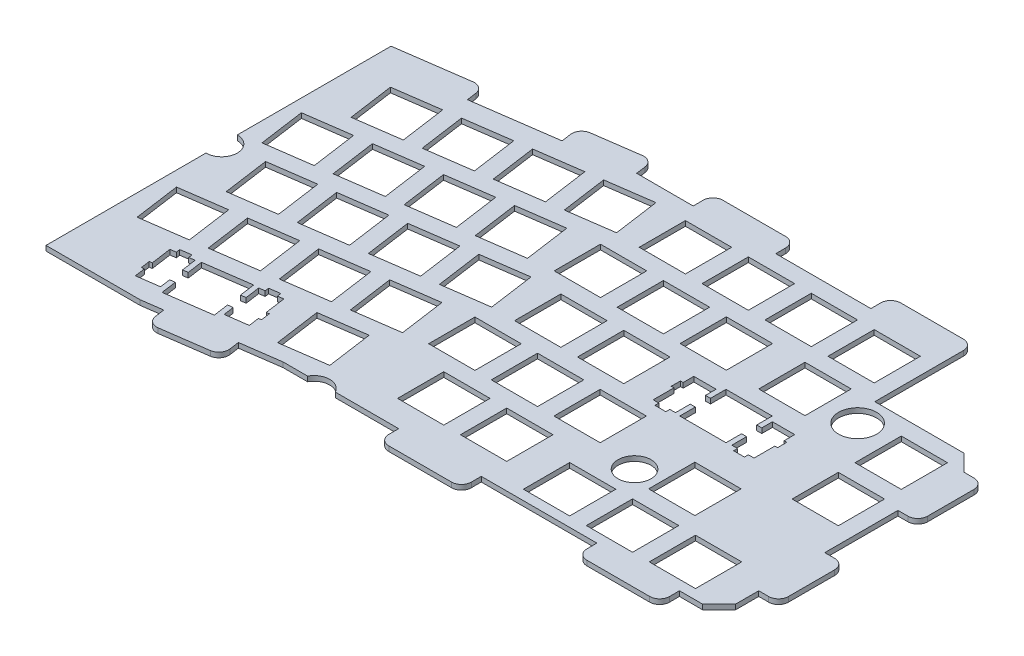
from build123d import *

# Parameters (mm, degrees)
BOSS_EXTRUDE1_DEPTH     = 1.5
SKETCH2_W               = 14
SKETCH2_H               = 14
CUT_EXTRUDE1_DEPTH      = 1.5
CUT_EXTRUDE2_DEPTH      = 10
SKETCH4_W               = 25
SKETCH4_H               = 6
SKETCH4_W_2             = 6
SKETCH4_H_2             = 20
BOSS_EXTRUDE2_DEPTH     = 1.5
FILLET1_R               = 3
CHAMFER1_SIZE           = 5
CUT_EXTRUDE3_DEPTH      = 356.457181103
SKETCH6_R               = 4.75
CUT_EXTRUDE4_DEPTH      = 10
SKETCH7_R               = 5.75
SKETCH7_R_2             = 5
CUT_EXTRUDE5_DEPTH      = 356.457181103
SKETCH8_W               = 5.051158106
SKETCH8_H               = 14
SKETCH8_W_2             = 3.300200616
SKETCH8_H_2             = 0.970158975
BOSS_EXTRUDE3_DEPTH     = 1.5
CUT_EXTRUDE6_DEPTH      = 356.457181103
CUT_EXTRUDE6_DEPTH_BACK = 356.457181103
SKETCH9_R               = 4.75
SKETCH11_W              = 14
SKETCH11_H              = 14
BOSS_EXTRUDE4_DEPTH     = 1.5
SKETCH12_W              = 14
SKETCH12_H              = 14
CUT_EXTRUDE7_DEPTH      = 1.5


with BuildPart() as part:
    # Sketch1 → Boss-Extrude1 (new body)
    with BuildSketch(Plane(origin=(0, 0, 0), x_dir=(1, 0, 0), z_dir=(0, 1, 0))):
        Polygon((219.154120864, 94.45473243), (218.917531506, 96.138153182), (136.518193504, 84.557681441), (136.518193504, -13.847404885), (165.025737092, -13.847404885), (202.983711168, -8.512759525), (334.96393406, -8.512759525), (334.96393406, 70.640784798), (302.956988381, 70.640784798), (302.956988381, 94.45473243), align=None)
    extrude(amount=-BOSS_EXTRUDE1_DEPTH)

    # Sketch2 → Cut-Extrude1 (cut)
    with BuildSketch(Plane(origin=(0, 0, 0), x_dir=(1, 0, 0), z_dir=(0, 1, 0))):
        with Locations((9.668032188, 45.102416218)):
            Rectangle(SKETCH2_W, SKETCH2_H)
        with Locations((35.863224574, 45.102416218)):
            Rectangle(SKETCH2_W, SKETCH2_H)
        with Locations((234.185537286, 44.352416218)):
            Rectangle(SKETCH2_W, SKETCH2_H)
        Polygon((178.121091859, 64.90183983), (180.069515273, 51.038086867), (193.933268235, 52.986510281), (191.984844822, 66.850263243), align=None)
        Polygon((104.751422203, 50.596042214), (118.615175166, 48.647618801), (120.563598579, 62.511371763), (106.699845617, 64.459795177), align=None)
        Polygon((159.255744418, 62.251705375), (161.204167832, 48.387952413), (175.067920794, 50.336375826), (173.119497381, 64.200128789), align=None)
        Polygon((156.202060214, 47.682978456), (154.2536368, 61.546731419), (140.389883838, 59.598308005), (142.338307252, 45.734555043), align=None)
        Polygon((67.01983917, 55.898963137), (80.883592133, 53.950539723), (82.832015546, 67.814292686), (68.968262584, 69.762716099), align=None)
        Polygon((196.986368764, 67.55257549), (198.934792178, 53.688822528), (212.79854514, 55.637245941), (210.850121727, 69.500998903), align=None)
        with Locations((322.96393406, 58.640784798)):
            Rectangle(SKETCH2_W, SKETCH2_H)
        Polygon((101.698031366, 65.162288715), (87.834278404, 67.110712128), (85.88585499, 53.246959166), (99.749607953, 51.298535752), align=None)
        with Locations((246.187266863, 63.403574324)):
            Rectangle(SKETCH2_W, SKETCH2_H)
        with Locations((265.238424969, 63.403574324)):
            Rectangle(SKETCH2_W, SKETCH2_H)
        with Locations((289.052872631, 63.403574324)):
            Rectangle(SKETCH2_W, SKETCH2_H)
        Polygon((63.963767514, 70.467972336), (50.100014552, 72.41639575), (48.151591138, 58.552642788), (62.015344101, 56.604219374), align=None)
        Polygon((157.569996377, -5.102507014), (158.019711747, -8.301004785), (164.704915811, -7.359709504), (164.255200441, -4.161211733), (165.765246552, -3.948673985), (166.419287381, -8.602416301), (180.283040344, -6.653992888), (179.628767758, -1.998601538), (181.13993164, -1.786902128), (181.588872068, -4.985649306), (188.272596855, -4.049463377), (187.823656903, -0.849316114), (188.6407454, -0.735186804), (188.253885303, 2.036137069), (187.435796745, 1.9220081), (186.565853923, 8.132131561), (184.856668188, 7.891577681), (184.690062177, 9.080936661), (181.421707286, 8.621759261), (181.589313822, 7.433770026), (179.880128073, 7.193176143), (180.501662214, 2.767805684), (178.991498382, 2.556075933), (178.33804004, 7.210241161), (164.474287078, 5.261817748), (165.12645598, 0.606352683), (163.616324776, 0.395822335), (162.9951147, 4.821087611), (161.286966042, 4.58161254), (161.120178356, 5.770966057), (157.852893703, 5.311279215), (158.019681648, 4.123305782), (156.308920813, 3.883635048), (157.179376197, -2.329822426), (156.36335122, -2.444404927), (156.7539714, -5.217089515), align=None)
        Polygon((147.169538506, 79.78393588), (149.11796192, 65.920182917), (162.981714882, 67.868606331), (161.033291469, 81.732359293), align=None)
        with Locations((9.953349532, 64.153574324)):
            Rectangle(SKETCH2_W, SKETCH2_H)
        with Locations((33.76869725, 64.153574324)):
            Rectangle(SKETCH2_W, SKETCH2_H)
        with Locations((227.136108757, 63.403574324)):
            Rectangle(SKETCH2_W, SKETCH2_H)
        with Locations((317.819621341, 1.487240475)):
            Rectangle(SKETCH2_W, SKETCH2_H)
        Polygon((184.901939327, 85.090868736), (186.85036274, 71.227115774), (200.714115703, 73.175539187), (198.765692289, 87.03929215), align=None)
        Polygon((97.969882094, 70.788131208), (111.833635057, 68.839707794), (113.78205847, 82.703460757), (99.918305508, 84.65188417), align=None)
        Polygon((166.036357138, 82.44130638), (167.984780551, 68.577553418), (181.848533513, 70.525976831), (179.9001101, 84.389729793), align=None)
        Polygon((132.646503169, 80.052339146), (118.782750207, 82.000762559), (116.834326793, 68.137009597), (130.698079756, 66.188586183), align=None)
        Polygon((111.104192143, 1.378248006), (109.593099656, 1.590456432), (110.248125689, 6.245741363), (96.384372727, 8.194164776), (95.729632386, 3.541837354), (94.220537055, 3.75272446), (94.842499419, 8.180604226), (93.133391438, 8.420389682), (93.30138141, 9.608264754), (90.032374871, 10.06713695), (89.865884991, 8.879161897), (88.158277101, 9.118947378), (87.284529769, 2.910555086), (86.467478152, 3.024948118), (86.077301679, 0.252072909), (86.894753343, 0.136379804), (86.445280497, -3.060922216), (93.130602906, -4.000655434), (93.579575699, -0.802063343), (95.090671173, -1.014250495), (94.435710678, -5.669554648), (108.29946364, -7.617978062), (108.95488455, -2.964078805), (110.464958957, -3.176515366), (110.015669744, -6.375063026), (116.69899904, -7.315467432), (117.15028849, -4.11550985), (117.967328677, -4.231333791), (118.357579438, -1.458557181), (117.540539141, -1.344083322), (118.412100582, 4.865622818), (116.701521361, 5.106091194), (116.868527992, 6.295363984), (113.601328022, 6.754282206), (113.434321388, 5.566309496), (111.725216783, 5.806119012), align=None)
        Polygon((56.705785596, -0.366770729), (70.569538559, -2.315194142), (72.517961972, 11.54855882), (58.65420901, 13.496982234), align=None)
        Polygon((195.130066004, 9.567109615), (197.078489417, -4.296643347), (210.94224238, -2.348219934), (208.993818966, 11.515533029), align=None)
        with Locations((279.717305129, 1.487240475)):
            Rectangle(SKETCH2_W, SKETCH2_H)
        with Locations((298.768463235, 1.487240475)):
            Rectangle(SKETCH2_W, SKETCH2_H)
        with Locations((322.96393406, 82.45473243)):
            Rectangle(SKETCH2_W, SKETCH2_H)
        Polygon((60.238294726, 76.091398208), (74.102047689, 74.142974794), (76.050471102, 88.006727757), (62.18671814, 89.95515117), align=None)
        Polygon((203.76774093, 87.743787929), (205.716164344, 73.880034967), (219.579917306, 75.828458381), (217.631493893, 89.692211343), align=None)
        Polygon((94.916594046, 85.354884074), (81.052841084, 87.303307487), (79.10441767, 73.439554525), (92.968170633, 71.491131111), align=None)
        with Locations((6.998481741, 7.003238337)):
            Rectangle(SKETCH2_W, SKETCH2_H)
        with Locations((30.815317716, 7)):
            Rectangle(SKETCH2_W, SKETCH2_H)
        with Locations((236.852699421, 6.25)):
            Rectangle(SKETCH2_W, SKETCH2_H)
        with Locations((255.901857405, 6.25)):
            Rectangle(SKETCH2_W, SKETCH2_H)
        with Locations((233.805365226, 82.45473243)):
            Rectangle(SKETCH2_W, SKETCH2_H)
        with Locations((252.853672108, 82.45473243)):
            Rectangle(SKETCH2_W, SKETCH2_H)
        with Locations((271.905830275, 82.45473243)):
            Rectangle(SKETCH2_W, SKETCH2_H)
        with Locations((290.956988381, 82.45473243)):
            Rectangle(SKETCH2_W, SKETCH2_H)
        Polygon((94.728498302, 13.53075447), (108.592251265, 11.582331056), (110.540674678, 25.446084019), (96.676921716, 27.394507432), align=None)
        Polygon((159.840121808, 23.854939719), (161.788545221, 9.991186757), (175.652298184, 11.93961017), (173.70387477, 25.803363133), align=None)
        Polygon((113.59645597, 10.87856864), (127.460208932, 8.930145226), (129.408632345, 22.793898189), (115.544879383, 24.742321602), align=None)
        Polygon((156.787145811, 9.288088686), (154.838722397, 23.151841648), (140.974969435, 21.203418235), (142.923392848, 7.339665272), align=None)
        Polygon((41.369964699, 78.743945848), (55.233717661, 76.795522435), (57.182141074, 90.659275397), (43.318388112, 92.607698811), align=None)
        with Locations((7.667010547, 83.205083501)):
            Rectangle(SKETCH2_W, SKETCH2_H)
        with Locations((26.718168653, 83.20473243)):
            Rectangle(SKETCH2_W, SKETCH2_H)
        Polygon((197.571649607, 29.156145338), (199.52007302, 15.292392375), (213.383825983, 17.240815789), (211.435402569, 31.104568751), align=None)
        with Locations((298.578451684, 20.53836858)):
            Rectangle(SKETCH2_W, SKETCH2_H)
        Polygon((75.864990972, 16.18027321), (89.728743935, 14.231849796), (91.677167348, 28.095602759), (77.813414386, 30.044026172), align=None)
        Polygon((194.518669396, 14.59087492), (192.570245983, 28.454627882), (178.70649302, 26.506204468), (180.654916434, 12.642451506), align=None)
        Polygon((72.814046306, 30.743764728), (58.950293343, 32.692188142), (57.00186993, 18.82843518), (70.865622892, 16.880011766), align=None)
        with Locations((246.187266863, 25.301158106)):
            Rectangle(SKETCH2_W, SKETCH2_H)
        with Locations((270.001714525, 25.301158106)):
            Rectangle(SKETCH2_W, SKETCH2_H)
        Polygon((106.817387518, 31.067584231), (120.681140481, 29.119160818), (122.629563894, 42.98291378), (108.765810932, 44.931337194), align=None)
        Polygon((147.757072306, 41.396446268), (149.70549572, 27.532693306), (163.569248682, 29.481116719), (161.620825269, 43.344869682), align=None)
        with Locations((42.722341535, 26.051158106)):
            Rectangle(SKETCH2_W, SKETCH2_H)
        with Locations((227.23185535, 25.301158106)):
            Rectangle(SKETCH2_W, SKETCH2_H)
        Polygon((29.421107438, 28.35187244), (29.421107438, 31.582068801), (22.671197116, 31.582068801), (22.671197116, 28.35187244), (21.145604376, 28.35187244), (21.145604376, 33.051158106), (7.145604376, 33.051158106), (7.145604376, 28.352123505), (5.620011636, 28.352123505), (5.620011636, 31.582319866), (-1.130048695, 31.582319866), (-1.130048695, 28.352123505), (-1.955568878, 28.352123505), (-1.955568878, 25.551953285), (-1.130048695, 25.551953285), (-1.130048695, 19.281372101), (0.594006109, 19.281372101), (0.594006109, 18.080999131), (3.894506744, 18.080999131), (3.894506744, 19.281372101), (5.620011636, 19.281372101), (5.620011636, 23.751943863), (7.145604376, 23.751943863), (7.145604376, 19.051158106), (21.145604376, 19.051158106), (21.145604376, 23.751943863), (22.671197116, 23.751943863), (22.671197116, 19.281372101), (24.395201917, 19.281372101), (24.395201917, 18.080999131), (27.695902564, 18.080999131), (27.695902564, 19.281372101), (29.421107438, 19.281372101), (29.421107438, 25.551953285), (30.245257537, 25.551953285), (30.245257537, 28.35187244), align=None)
        with Locations((322.96393406, 39.589626692)):
            Rectangle(SKETCH2_W, SKETCH2_H)
        Polygon((185.488788311, 46.697765029), (187.437211725, 32.834012067), (201.300964687, 34.78243548), (199.352541274, 48.646188443), align=None)
        Polygon((87.950744981, 33.718153821), (101.814497943, 31.769730407), (103.762921357, 45.63348337), (89.899168394, 47.581906783), align=None)
        Polygon((182.435238167, 32.133896486), (180.486814754, 45.997649448), (166.623061792, 44.049226035), (168.571485205, 30.185473073), align=None)
        Polygon((50.217381331, 39.02268098), (64.081134293, 37.074257567), (66.029557706, 50.938010529), (52.165804744, 52.886433942), align=None)
        Polygon((204.353981609, 49.347694991), (206.302405022, 35.483942028), (220.166157984, 37.432365442), (218.217734571, 51.296118404), align=None)
        Polygon((84.89758278, 48.285002771), (71.033829817, 50.233426184), (69.085406404, 36.369673222), (82.949159366, 34.421249808), align=None)
        with Locations((253.236695392, 44.352416218)):
            Rectangle(SKETCH2_W, SKETCH2_H)
        Polygon((294.443774816, 37.5824302), (294.443774816, 36.382257243), (297.743975432, 36.382257243), (297.743975432, 37.5824302), (299.470080361, 37.5824302), (299.470080361, 43.853111391), (300.294130454, 43.853111391), (300.294130454, 46.653130552), (299.470080361, 46.653130552), (299.470080361, 49.883326913), (292.719670009, 49.883326913), (292.719670009, 46.653130552), (291.194577299, 46.653130552), (291.194577299, 51.352416218), (277.194577299, 51.352416218), (277.194577299, 46.653281611), (275.66948459, 46.653281611), (275.66948459, 49.883477972), (268.919074237, 49.883477972), (268.919074237, 46.653281611), (268.094024083, 46.653281611), (268.094024083, 43.853111391), (268.919074237, 43.853111391), (268.919074237, 37.5824302), (270.643179045, 37.5824302), (270.643179045, 36.382257243), (273.943379661, 36.382257243), (273.943379661, 37.5824302), (275.66948459, 37.5824302), (275.66948459, 42.053101969), (277.194577299, 42.053101969), (277.194577299, 37.352416218), (291.194577299, 37.352416218), (291.194577299, 42.053101969), (292.719670009, 42.053101969), (292.719670009, 37.5824302), align=None)
    extrude(amount=-CUT_EXTRUDE1_DEPTH, mode=Mode.SUBTRACT)

    # Sketch3 → Cut-Extrude2 (cut)
    with BuildSketch(Plane(origin=(0, 0, 0), x_dir=(1, 0, 0), z_dir=(0, 1, 0))):
        Polygon((297.530962483, 84.755446764), (296.70691239, 84.755446764), (296.70691239, 87.985643125), (289.956502038, 87.985643125), (289.956502038, 84.755446764), (288.431409328, 84.755446764), (288.431409328, 89.45473243), (274.431409328, 89.45473243), (274.431409328, 84.755597823), (272.906316619, 84.755597823), (272.906316619, 87.985794184), (266.155906266, 87.985794184), (266.155906266, 84.755597823), (265.330856112, 84.755597823), (265.330856112, 81.955427603), (266.155906266, 81.955427603), (266.155906266, 75.684746413), (267.880011074, 75.684746413), (267.880011074, 74.484573455), (271.18021169, 74.484573455), (271.18021169, 75.684746413), (272.906316619, 75.684746413), (272.906316619, 80.155418181), (274.431409328, 80.155418181), (274.431409328, 75.45473243), (288.431409328, 75.45473243), (288.431409328, 80.155418181), (289.956502038, 80.155418181), (289.956502038, 75.684746413), (291.680606845, 75.684746413), (291.680606845, 74.484573455), (294.980807461, 74.484573455), (294.980807461, 75.684746413), (296.70691239, 75.684746413), (296.70691239, 81.955427603), (297.530962483, 81.955427603), align=None)
    extrude(amount=-CUT_EXTRUDE2_DEPTH, mode=Mode.SUBTRACT)

    # Sketch4 → Boss-Extrude2 (add)
    with BuildSketch(Plane(origin=(0, 0, 0), x_dir=(1, 0, 0), z_dir=(0, 1, 0))):
        with Locations((290.456988381, 97.45473243)):
            Rectangle(SKETCH4_W, SKETCH4_H)
        with Locations((236.654120864, 97.45473243)):
            Rectangle(SKETCH4_W, SKETCH4_H)
        with Locations((337.96393406, 55.640784798)):
            Rectangle(SKETCH4_W_2, SKETCH4_H_2)
        with Locations((337.96393406, 13.487240475)):
            Rectangle(SKETCH4_W_2, SKETCH4_H_2)
        with Locations((310.46393406, -11.512759525)):
            Rectangle(SKETCH4_W, SKETCH4_H)
        Polygon((207.034314681, 94.468075971), (187.228953307, 91.684613952), (186.393914701, 97.626222364), (206.199276076, 100.409684383), align=None)
        with Locations((250.46393406, -11.512759525)):
            Rectangle(SKETCH4_W, SKETCH4_H)
        Polygon((171.295132968, -12.966298755), (191.100494343, -10.182836736), (191.935532949, -16.124445149), (172.130171574, -18.907907168), align=None)
        Polygon((136.518193504, 84.557681441), (136.518193504, 90.616646876), (161.274895222, 94.0959744), (162.109933828, 88.154365987), align=None)
    extrude(amount=-BOSS_EXTRUDE2_DEPTH)

    # Fillet1
    fillet1_edges = [part.edges().sort_by_distance(p)[0] for p in [
        (302.956988381, -0.75, -100.45473243),
        (277.956988381, -0.75, -100.45473243),
        (224.154120864, -0.75, -100.45473243),
        (249.154120864, -0.75, -100.45473243),
        (340.96393406, -0.75, -65.640784798),
        (340.96393406, -0.75, -45.640784798),
        (340.96393406, -0.75, -23.487240475),
        (340.96393406, -0.75, -3.487240475),
        (322.96393406, -0.75, 14.512759525),
        (297.96393406, -0.75, 14.512759525),
        (262.96393406, -0.75, 14.512759525),
        (237.96393406, -0.75, 14.512759525),
        (206.199276076, -0.75, -100.409684383),
        (186.393914701, -0.75, -97.626222364),
        (172.130171574, -0.75, 18.907907168),
        (191.935532949, -0.75, 16.124445149),
        (161.274895222, -0.75, -94.0959744),
    ]]
    fillet(fillet1_edges, radius=FILLET1_R)

    # Chamfer1
    chamfer1_edges = [part.edges().sort_by_distance(p)[0] for p in [
        (334.96393406, -0.75, -70.640784798),
        (334.96393406, -0.75, 8.512759525),
    ]]
    chamfer(chamfer1_edges, length=CHAMFER1_SIZE - 0.0001)  # a hair under: the kernel refuses the full size

    # Sketch5 → Cut-Extrude3 (cut, through all)
    with BuildSketch(Plane(origin=(0, 0, 0), x_dir=(1, 0, 0), z_dir=(0, 1, 0))):
        Polygon((207.034314681, 94.468075971), (219.154120864, 94.45473243), (218.917531506, 96.138153182), align=None)
    extrude(amount=-CUT_EXTRUDE3_DEPTH, mode=Mode.SUBTRACT)

    # Sketch6 → Cut-Extrude4 (cut)
    with BuildSketch(Plane(origin=(0, 0, 0), x_dir=(1, 0, 0), z_dir=(0, 1, 0))):
        with Locations((136.518193504, 39.320563904)):
            Circle(SKETCH6_R)
    extrude(amount=-CUT_EXTRUDE4_DEPTH, mode=Mode.SUBTRACT)

    # Sketch7 → Cut-Extrude5 (cut, through all)
    with BuildSketch(Plane.XZ.offset(1.5)):
        with Locations(Location((306.008403346, -62.390784798, 0), (0, 0, 270))):
            Circle(SKETCH7_R)
        with Locations(Location((284.290083105, -16.563977634, 0), (0, 0, 270))):
            Circle(SKETCH7_R_2)
    extrude(amount=-CUT_EXTRUDE5_DEPTH, mode=Mode.SUBTRACT)

    # Sketch8 → Boss-Extrude3 (add)
    with BuildSketch(Plane(origin=(0, 0, 0), x_dir=(1, 0, 0), z_dir=(0, 1, 0))):
        with Locations((281.431409328, 82.45473243)):
            Rectangle(SKETCH8_W, SKETCH8_H)
        with Locations((269.530111382, 74.969652943)):
            Rectangle(SKETCH8_W_2, SKETCH8_H_2)
        with Locations((293.330707153, 74.969652943)):
            Rectangle(SKETCH8_W_2, SKETCH8_H_2)
    extrude(amount=-BOSS_EXTRUDE3_DEPTH)

    # Sketch9 → Cut-Extrude6 (cut, two sides: drawn at the far end of the back side and taken through both)
    with BuildSketch(Plane.XZ.offset(1.5).offset(-CUT_EXTRUDE6_DEPTH_BACK)):
        with Locations((214.58256585, 10.760697733)):
            Circle(SKETCH9_R)
    extrude(amount=CUT_EXTRUDE6_DEPTH + CUT_EXTRUDE6_DEPTH_BACK, mode=Mode.SUBTRACT)

    # Sketch11 → Boss-Extrude4 (add)
    with BuildSketch(Plane(origin=(0, 0, 0), x_dir=(1, 0, 0), z_dir=(0, 1, 0))):
        with Locations((270.001714525, 25.301158106)):
            Rectangle(SKETCH11_W, SKETCH11_H)
    extrude(amount=-BOSS_EXTRUDE4_DEPTH)

    # Sketch12 → Cut-Extrude7 (cut)
    with BuildSketch(Plane(origin=(0, 0, 0), x_dir=(1, 0, 0), z_dir=(0, 1, 0))):
        with Locations((265.147266863, 25.301158106)):
            Rectangle(SKETCH12_W, SKETCH12_H)
    extrude(amount=-CUT_EXTRUDE7_DEPTH, mode=Mode.SUBTRACT)


solid = part.part
